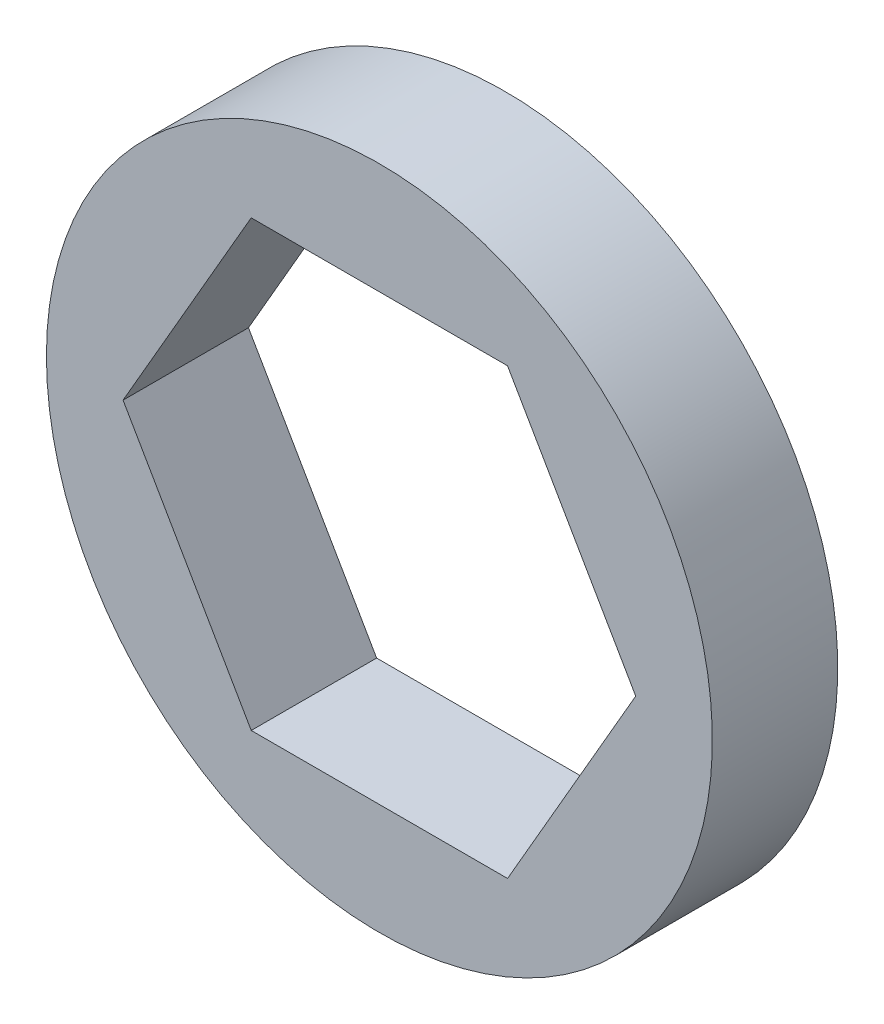
from build123d import *

# Parameters (mm, degrees)
SKETCH1_R           = 9.525
BOSS_EXTRUDE1_DEPTH = 3.587496


with BuildPart() as part:
    # Sketch1 → Boss-Extrude1 (new body)
    with BuildSketch(Plane.XY):
        Circle(SKETCH1_R)
        Polygon((3.666174209, 6.35), (-3.666174209, 6.35), (-7.332348419, 0), (-3.666174209, -6.35), (3.666174209, -6.35), (7.332348419, 0), align=None, mode=Mode.SUBTRACT)
    extrude(amount=BOSS_EXTRUDE1_DEPTH)


solid = part.part
